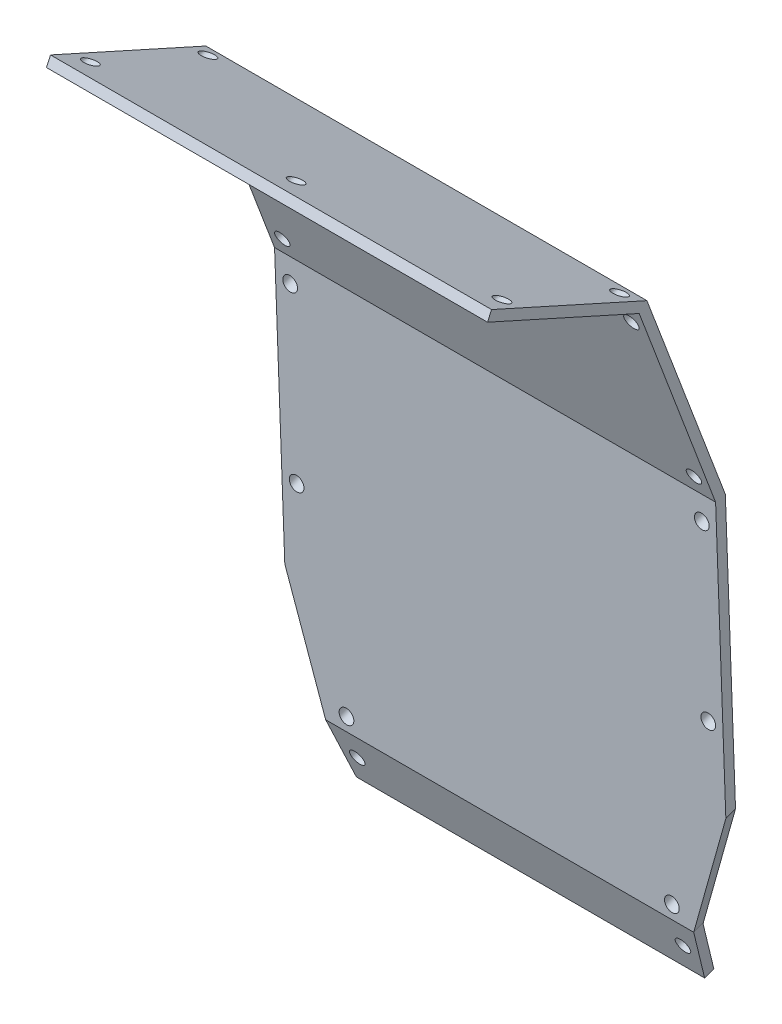
from build123d import *

# Parameters (mm, degrees)
EXTRUDE_THIN1_START     = -45
EXTRUDE_THIN1_DEPTH     = 45
CUT_EXTRUDE1_DEPTH      = 157.731887985
CUT_EXTRUDE1_DEPTH_BACK = 157.731887985
CUT_EXTRUDE2_DEPTH      = 157.731887985
CUT_EXTRUDE2_DEPTH_BACK = 157.731887985
CAVITY3_START           = -70.024794399
CAVITY3_OUTLINE_R       = 0.75
CAVITY3_DEPTH           = 14


# Read off the part's stored shape, not the designer's step: Cavity3
with BuildPart() as part:
    # Sketch1 → Extrude-Thin1 (new body)
    with BuildSketch(Plane.ZY.offset(150.764954356).offset(EXTRUDE_THIN1_START)):
        Polygon((79.416347767, 14.773148437), (63.942197239, 7.80531768), (56.144737449, -12.766498496), (54.655256011, -53.374766682), (52.528676068, -58.985262003), (51.593593514, -58.630832013), (53.661949456, -53.173947417), (55.151430894, -12.565679232), (63.153924395, 8.547071547), (79.005764402, 15.684971501), align=None)
    extrude(amount=EXTRUDE_THIN1_DEPTH)

    # Sketch2 → Cut-Extrude1 (cut, two sides: drawn at the far end of the back side and taken through both)
    with BuildSketch(Plane(origin=(0, -24.818887212, 65.478963555), x_dir=(-1, 0, 0), z_dir=(0, -0.3544299904759613, 0.9350825534952569)).offset(-CUT_EXTRUDE1_DEPTH_BACK)):
        Polygon((114.773321994, 221.888684389), (146.029710169, 36.538351254), (147.04151482, 30.538351254), (150.764954356, 19.038351254), (208.665239547, -159.789120823), (573.716552875, -69.987284443), (479.824635322, 311.690520769), align=None)
    extrude(amount=CUT_EXTRUDE1_DEPTH + CUT_EXTRUDE1_DEPTH_BACK, mode=Mode.SUBTRACT)

    # Sketch3 → Cut-Extrude2 (cut, two sides: drawn at the far end of the back side and taken through both)
    with BuildSketch(Plane(origin=(0, -24.818887212, 65.478963555), x_dir=(-1, 0, 0), z_dir=(0, -0.3544299904759613, 0.9350825534952569)).offset(-CUT_EXTRUDE2_DEPTH_BACK)):
        Polygon((141.756586717, 221.888684389), (110.500198543, 36.538351254), (109.488393892, 30.538351254), (105.764954356, 19.038351254), (47.864669164, -159.789120823), (-317.186644163, -69.987284443), (-223.29472661, 311.690520769), align=None)
    extrude(amount=CUT_EXTRUDE2_DEPTH + CUT_EXTRUDE2_DEPTH_BACK, mode=Mode.SUBTRACT)

    # Cavity3 outline → Cavity3 (cut)
    with BuildSketch(Plane(origin=(0, 0, 0), x_dir=(1, 0, 0), z_dir=(0, 0.3544299904767, -0.935082553494977)).offset(CAVITY3_START)):
        with BuildLine():
            add(Edge.make_bspline(
                [(-128.264954356, -41.211648746), (-126.96591625, -41.211648746), (-127.615435303, -40.416153617), (-128.264954356, -39.620658488), (-128.914473409, -40.416153617), (-129.563992462, -41.211648746), (-128.264954356, -41.211648746)],
                knots=[0, 0, 0, 2.094395102, 2.094395102, 4.188790205, 4.188790205, 6.283185307, 6.283185307, 6.283185307], degree=2, weights=[1, 0.5, 1, 0.5, 1, 0.5, 1]))
        make_face()
        with BuildLine():
            add(Edge.make_bspline(
                [(-107.264954356, -30.845532222), (-108.563992462, -30.845532222), (-107.914473409, -31.641027351), (-107.264954356, -32.43652248), (-106.615435303, -31.641027351), (-105.96591625, -30.845532222), (-107.264954356, -30.845532222)],
                knots=[0, 0, 0, 2.094395102, 2.094395102, 4.188790205, 4.188790205, 6.283185307, 6.283185307, 6.283185307], degree=2, weights=[1, 0.5, 1, 0.5, 1, 0.5, 1]))
        make_face()
        with BuildLine():
            add(Edge.make_bspline(
                [(-107.264954356, -40.150988574), (-108.563992462, -40.150988574), (-107.914473409, -40.946483703), (-107.264954356, -41.741978832), (-106.615435303, -40.946483703), (-105.96591625, -40.150988574), (-107.264954356, -40.150988574)],
                knots=[0, 0, 0, 2.094395102, 2.094395102, 4.188790205, 4.188790205, 6.283185307, 6.283185307, 6.283185307], degree=2, weights=[1, 0.5, 1, 0.5, 1, 0.5, 1]))
        make_face()
        with BuildLine():
            add(Edge.make_bspline(
                [(-149.264954356, -41.211648746), (-147.96591625, -41.211648746), (-148.615435303, -40.416153617), (-149.264954356, -39.620658488), (-149.914473409, -40.416153617), (-150.563992462, -41.211648746), (-149.264954356, -41.211648746)],
                knots=[0, 0, 0, 2.094395102, 2.094395102, 4.188790205, 4.188790205, 6.283185307, 6.283185307, 6.283185307], degree=2, weights=[1, 0.5, 1, 0.5, 1, 0.5, 1]))
        make_face()
        with BuildLine():
            add(Edge.make_bspline(
                [(-149.264954356, -31.906192394), (-147.96591625, -31.906192394), (-148.615435303, -31.110697265), (-149.264954356, -30.315202137), (-149.914473409, -31.110697265), (-150.563992462, -31.906192394), (-149.264954356, -31.906192394)],
                knots=[0, 0, 0, 2.094395102, 2.094395102, 4.188790205, 4.188790205, 6.283185307, 6.283185307, 6.283185307], degree=2, weights=[1, 0.5, 1, 0.5, 1, 0.5, 1]))
        make_face()
        with BuildLine():
            add(Edge.make_bspline(
                [(-149.264954356, -4.882450326), (-150.563992462, -4.882450326), (-149.914473409, -5.948326702), (-149.264954356, -7.014203078), (-148.615435303, -5.948326702), (-147.96591625, -4.882450326), (-149.264954356, -4.882450326)],
                knots=[0, 0, 0, 2.094395102, 2.094395102, 4.188790205, 4.188790205, 6.283185307, 6.283185307, 6.283185307], degree=2, weights=[1, 0.5, 1, 0.5, 1, 0.5, 1]))
        make_face()
        with BuildLine():
            add(Edge.make_bspline(
                [(-149.264954356, 12.169370164), (-150.563992462, 12.169370164), (-149.914473409, 11.103493788), (-149.264954356, 10.037617412), (-148.615435303, 11.103493788), (-147.96591625, 12.169370164), (-149.264954356, 12.169370164)],
                knots=[0, 0, 0, 2.094395102, 2.094395102, 4.188790205, 4.188790205, 6.283185307, 6.283185307, 6.283185307], degree=2, weights=[1, 0.5, 1, 0.5, 1, 0.5, 1]))
        make_face()
        with BuildLine():
            add(Edge.make_bspline(
                [(-144.864761686, 29.913849074), (-146.163799792, 29.913849074), (-145.514280739, 28.847972698), (-144.864761686, 27.782096322), (-144.215242633, 28.847972698), (-143.56572358, 29.913849074), (-144.864761686, 29.913849074)],
                knots=[0, 0, 0, 2.094395102, 2.094395102, 4.188790205, 4.188790205, 6.283185307, 6.283185307, 6.283185307], degree=2, weights=[1, 0.5, 1, 0.5, 1, 0.5, 1]))
        make_face()
        with BuildLine():
            add(Edge.make_bspline(
                [(-111.665147026, 28.492680573), (-110.36610892, 28.492680573), (-111.015627973, 29.558556949), (-111.665147026, 30.624433325), (-112.314666079, 29.558556949), (-112.964185131, 28.492680573), (-111.665147026, 28.492680573)],
                knots=[0, 0, 0, 2.094395102, 2.094395102, 4.188790205, 4.188790205, 6.283185307, 6.283185307, 6.283185307], degree=2, weights=[1, 0.5, 1, 0.5, 1, 0.5, 1]))
        make_face()
        with BuildLine():
            add(Edge.make_bspline(
                [(-107.264954356, 10.748201663), (-105.96591625, 10.748201663), (-106.615435303, 11.814078039), (-107.264954356, 12.879954415), (-107.914473409, 11.814078039), (-108.563992462, 10.748201663), (-107.264954356, 10.748201663)],
                knots=[0, 0, 0, 2.094395102, 2.094395102, 4.188790205, 4.188790205, 6.283185307, 6.283185307, 6.283185307], degree=2, weights=[1, 0.5, 1, 0.5, 1, 0.5, 1]))
        make_face()
        with BuildLine():
            add(Edge.make_bspline(
                [(-107.264954356, -6.303618828), (-105.96591625, -6.303618828), (-106.615435303, -5.237742452), (-107.264954356, -4.171866076), (-107.914473409, -5.237742452), (-108.563992462, -6.303618828), (-107.264954356, -6.303618828)],
                knots=[0, 0, 0, 2.094395102, 2.094395102, 4.188790205, 4.188790205, 6.283185307, 6.283185307, 6.283185307], degree=2, weights=[1, 0.5, 1, 0.5, 1, 0.5, 1]))
        make_face()
        with Locations((-149.264954356, -9.961648746)):
            Circle(CAVITY3_OUTLINE_R)
        with Locations((-149.264954356, -27.961648746)):
            Circle(CAVITY3_OUTLINE_R)
        with Locations((-107.264954356, -27.961648746)):
            Circle(CAVITY3_OUTLINE_R)
        with Locations((-107.264954356, -9.961648746)):
            Circle(CAVITY3_OUTLINE_R)
        with Locations((-144.882134477, 33.538351254)):
            Circle(CAVITY3_OUTLINE_R)
        with Locations((-111.647774235, 33.538351254)):
            Circle(CAVITY3_OUTLINE_R)
    extrude(amount=CAVITY3_DEPTH, mode=Mode.SUBTRACT)


solid = part.part
